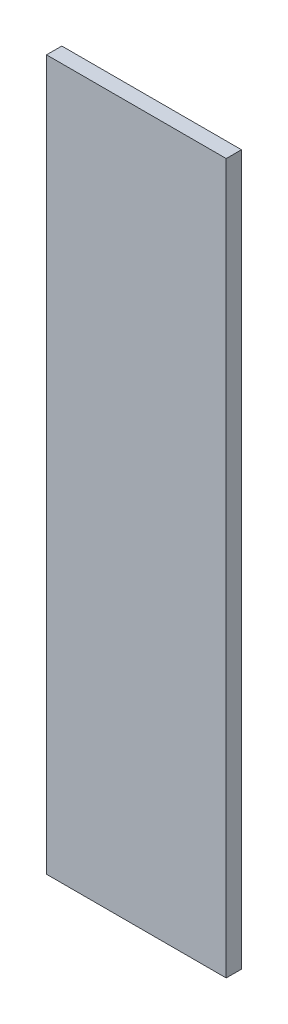
from build123d import *

# Parameters (mm, degrees)
SKETCH1_W           = 20
SKETCH1_H           = 79
BOSS_EXTRUDE1_DEPTH = 1.7


with BuildPart() as part:
    # Sketch1 → Boss-Extrude1 (new body)
    with BuildSketch(Plane.XY):
        Rectangle(SKETCH1_W, SKETCH1_H)
    extrude(amount=BOSS_EXTRUDE1_DEPTH)


solid = part.part
